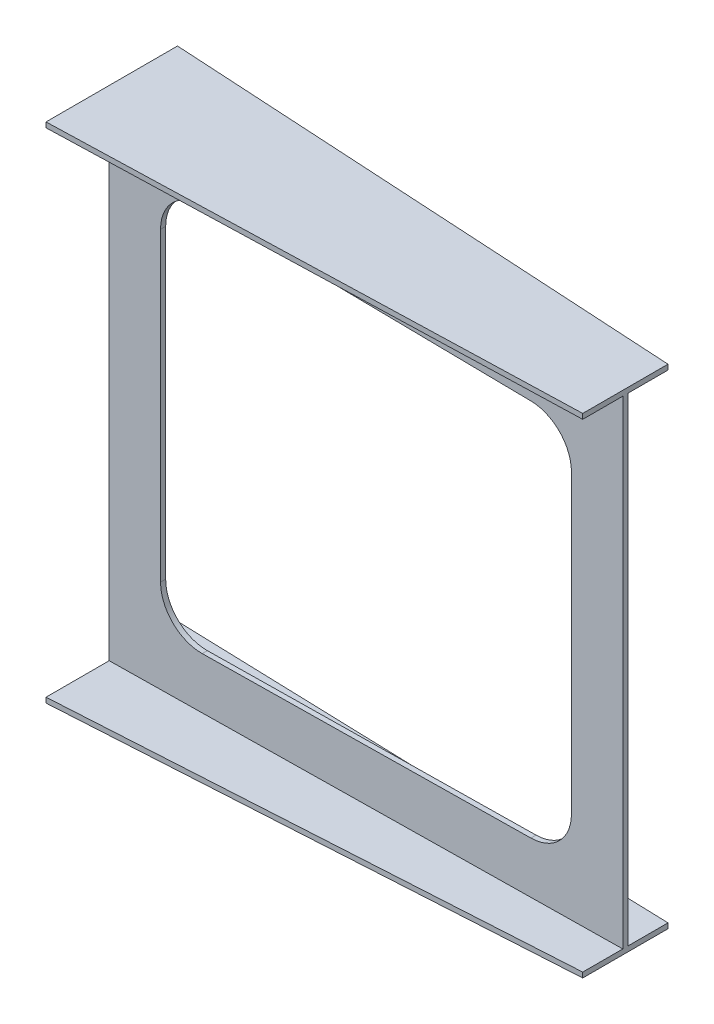
from build123d import *

# Parameters (mm, degrees)
CUT_EXTRUDE1_DEPTH = 1122.511926073


with BuildPart() as part:
    # Sketch1 → Loft l1 section 0
    with BuildSketch(Plane(origin=(0, 0, 0), x_dir=(0, 0, -1), z_dir=(1, 0, 0))):
        with BuildLine():
            Line((-133, 490), (123, 490))
            Line((123, 490), (123, 480))
            Line((123, 480), (0, 480))
            Line((0, 480), (0, -480))
            Line((0, -480), (123, -480))
            Line((123, -480), (123, -490))
            Line((123, -490), (-133, -490))
            Line((-133, -490), (-133, -480))
            Line((-133, -480), (-10, -480))
            Line((-10, -480), (-10, 480))
            Line((-10, 480), (-133, 480))
            Line((-133, 480), (-133, 490))
        make_face()
    # Sketch4 → Loft l1 section 1
    with BuildSketch(Plane(origin=(1000, 0, -1000), x_dir=(0, 0, 1), z_dir=(-1, 0, 0))):
        with BuildLine():
            Line((922, 476), (1088, 476))
            Line((1088, 476), (1088, 466))
            Line((1088, 466), (1010, 466))
            Line((1010, 466), (1010, -466))
            Line((1010, -466), (1088, -466))
            Line((1088, -466), (1088, -476))
            Line((1088, -476), (922, -476))
            Line((922, -476), (922, -466))
            Line((922, -466), (1000, -466))
            Line((1000, -466), (1000, 466))
            Line((1000, 466), (922, 466))
            Line((922, 466), (922, 476))
        make_face()
    loft()

    # Sketch6 → Cut-Extrude1 (cut, through all)
    with BuildSketch(Plane.XY.offset(10)):
        with BuildLine():
            Line((181.119890256, -377.454522017), (821.119890256, -368.494522017))
            ThreePointArc((821.119890256, -368.494522017), (876.963107449, -344.67356692), (900, -288.502360864))
            Line((900, -288.502360864), (900, 288.502360864))
            ThreePointArc((900, 288.502360864), (876.963107449, 344.67356692), (821.119890256, 368.494522017))
            Line((821.119890256, 368.494522017), (181.119890256, 377.454522017))
            ThreePointArc((181.119890256, 377.454522017), (123.828793944, 354.425468313), (100, 297.462360864))
            Line((100, 297.462360864), (100, -297.462360864))
            ThreePointArc((100, -297.462360864), (123.828793944, -354.425468313), (181.119890256, -377.454522017))
        make_face()
    extrude(amount=-CUT_EXTRUDE1_DEPTH, mode=Mode.SUBTRACT)


solid = part.part
